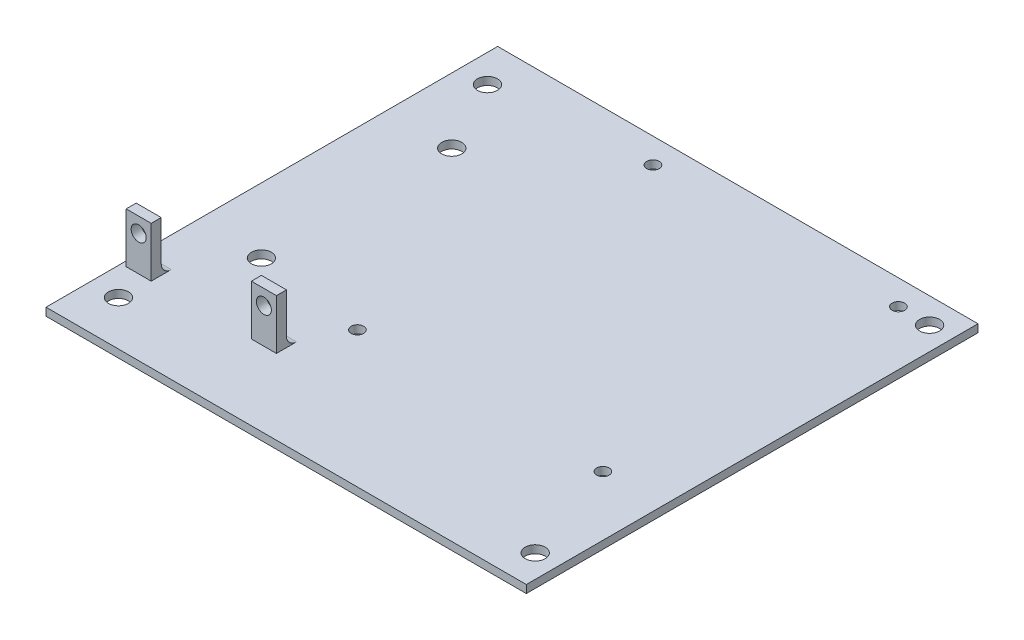
from build123d import *

# Parameters (mm, degrees)
SKETCH1_W               = 96.89
SKETCH1_H               = 90.17
PCB_DEPTH               = 1.57
SKETCH2_R               = 2
M3_MOUNTING_HOLES_DEPTH = 1.57
SKETCH5_W               = 0.5
SKETCH5_H               = 90.17
CUT_EXTRUDE1_DEPTH      = 127.49657684
SKETCH8_R               = 1.25
RPI_MOUNTING_HOLE_DEPTH = 10
SKETCH9_R               = 2
POWERADAPTERHOLES_DEPTH = 10
SKETCH10_W              = 5
SKETCH10_H              = 2
DSUB_HOLDER_DEPTH       = 10
FILLET2_R               = 2
DSUB_FIELDS_REACH       = 101.494
SKETCH11_R              = 1.5


with BuildPart() as part:
    # Sketch1 → PCB (new body)
    with BuildSketch(Plane(origin=(0, 0, 0), x_dir=(1, 0, 0), z_dir=(0, 1, 0))):
        with Locations((16.200949951, 63.633996534)):
            Rectangle(SKETCH1_W, SKETCH1_H)
    extrude(amount=PCB_DEPTH)

    # Sketch2 → M3 Mounting Holes (cut)
    with BuildSketch(Plane(origin=(0, 1.57, 0), x_dir=(1, 0, 0), z_dir=(0, 1, 0))):
        with Locations((59.565949951, 24.898996534)):
            Circle(SKETCH2_R)
        with Locations((-26.164050049, 27.438996534)):
            Circle(SKETCH2_R)
        with Locations((-26.164050049, 101.098996534)):
            Circle(SKETCH2_R)
        with Locations((59.565949951, 103.638996534)):
            Circle(SKETCH2_R)
    extrude(amount=-M3_MOUNTING_HOLES_DEPTH, mode=Mode.SUBTRACT)

    # Sketch5 → Cut-Extrude1 (cut, through all)
    with BuildSketch(Plane(origin=(0, 1.57, 0), x_dir=(1, 0, 0), z_dir=(0, 1, 0))):
        with Locations((-31.994050049, 63.633996534)):
            Rectangle(SKETCH5_W, SKETCH5_H)
        with Locations((64.395949951, 63.633996534)):
            Rectangle(SKETCH5_W, SKETCH5_H)
    extrude(amount=-CUT_EXTRUDE1_DEPTH, mode=Mode.SUBTRACT)

    # Sketch8 → RPi mounting hole (cut)
    with BuildSketch(Plane(origin=(0, 1.57, 0), x_dir=(1, 0, 0), z_dir=(0, 1, 0))):
        with Locations((3.255949951, 45.718996534)):
            Circle(SKETCH8_R)
        with Locations((52.255949951, 45.718996534)):
            Circle(SKETCH8_R)
        with Locations((4.255949951, 103.718996534)):
            Circle(SKETCH8_R)
        with Locations((53.255949951, 103.718996534)):
            Circle(SKETCH8_R)
    extrude(amount=-RPI_MOUNTING_HOLE_DEPTH, mode=Mode.SUBTRACT)

    # Sketch9 → PowerAdapterHoles (cut)
    with BuildSketch(Plane(origin=(0, 1.57, 0), x_dir=(1, 0, 0), z_dir=(0, 1, 0))):
        with Locations((-18.744050049, 86.548996534)):
            Circle(SKETCH9_R)
        with Locations((-18.744050049, 48.548996534)):
            Circle(SKETCH9_R)
    extrude(amount=-POWERADAPTERHOLES_DEPTH, mode=Mode.SUBTRACT)

    # Sketch10 → DSub Holder (add)
    with BuildSketch(Plane(origin=(0, 1.57, 0), x_dir=(1, 0, 0), z_dir=(0, 1, 0))):
        with Locations((-28.244050049, 34.548996534)):
            Rectangle(SKETCH10_W, SKETCH10_H)
        with Locations((-3.244050049, 34.548996534)):
            Rectangle(SKETCH10_W, SKETCH10_H)
    extrude(amount=DSUB_HOLDER_DEPTH)

    # Fillet2
    fillet2_edges = [part.edges().sort_by_distance(p)[0] for p in [
        (-28.244050049, 1.57, -35.548996534),
        (-3.244050049, 1.57, -35.548996534),
    ]]
    fillet(fillet2_edges, radius=FILLET2_R)

    # Sketch11 → DSub Fields (cut, up to next)
    with BuildSketch(Plane.XY.offset(-33.548996534), mode=Mode.PRIVATE) as dsub_fields_sk1:
        with Locations((-28.244050049, 8.57)):
            Circle(SKETCH11_R)
    dsub_fields_tool1 = extrude(dsub_fields_sk1.sketch, amount=-DSUB_FIELDS_REACH, mode=Mode.PRIVATE) & part.part
    # Sketch11 → DSub Fields (cut, up to next)
    with BuildSketch(Plane.XY.offset(-33.548996534), mode=Mode.PRIVATE) as dsub_fields_sk2:
        with Locations((-3.254050049, 8.57)):
            Circle(SKETCH11_R)
    dsub_fields_tool2 = extrude(dsub_fields_sk2.sketch, amount=-DSUB_FIELDS_REACH, mode=Mode.PRIVATE) & part.part
    add(dsub_fields_tool1.solids().sort_by_distance((-28.24405, 8.57, -33.548997))[0], mode=Mode.SUBTRACT)
    add(dsub_fields_tool2.solids().sort_by_distance((-3.25405, 8.57, -33.548997))[0], mode=Mode.SUBTRACT)


solid = part.part
